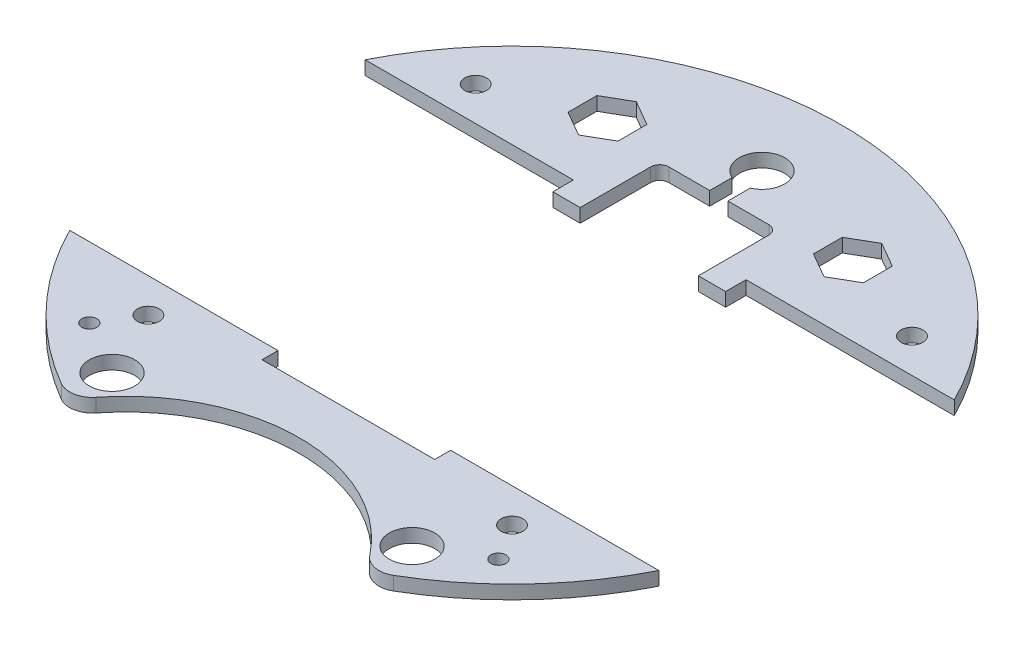
from build123d import *

# Parameters (mm, degrees)
BOSS_EXTRUDE1_DEPTH  = 3
SOLENOID_PLACEMENT_W = 38
SOLENOID_PLACEMENT_H = 64
CUT_EXTRUDE1_DEPTH   = 103.574363269
CUT_EXTRUDE5_DEPTH   = 103.574363269
SKETCH6_R            = 2.4
CUT_EXTRUDE6_DEPTH   = 103.574363269
CUT_EXTRUDE3_DEPTH   = 103.574363269
CUT_EXTRUDE7_DEPTH   = 98.289516393
SKETCH8_R            = 5
CUT_EXTRUDE8_DEPTH   = 98.289516393
CUT_EXTRUDE9_DEPTH   = 98.289516393
SKETCH10_R           = 1.65
CUT_EXTRUDE10_DEPTH  = 10


with BuildPart() as part:
    # Sketch1 → Boss-Extrude1 (new body)
    with BuildSketch(Plane(origin=(0, 0, 0), x_dir=(1, 0, 0), z_dir=(0, 1, 0))):
        with BuildLine():
            ThreePointArc((36.543377003, -62.616544118), (0, 72.5), (-36.543377003, -62.616544118))
            ThreePointArc((-36.543377003, -62.616544118), (-33.085954668, -63.20954405), (-30.089832649, -61.38507948))
            ThreePointArc((-30.089832649, -61.38507948), (0, -46.75), (30.089832649, -61.38507948))
            ThreePointArc((30.089832649, -61.38507948), (33.085954668, -63.20954405), (36.543377003, -62.616544118))
        make_face()
    extrude(amount=BOSS_EXTRUDE1_DEPTH)

    # solenoid placement → Cut-Extrude1 (cut, through all)
    with BuildSketch(Plane(origin=(0, 3, 0), x_dir=(1, 0, 0), z_dir=(0, 1, 0))):
        with Locations((0, -4)):
            Rectangle(SOLENOID_PLACEMENT_W, SOLENOID_PLACEMENT_H)
    extrude(amount=-CUT_EXTRUDE1_DEPTH, mode=Mode.SUBTRACT)

    # Sketch5 → Cut-Extrude5 (cut, through all)
    with BuildSketch(Plane(origin=(0, 3, 0), x_dir=(1, 0, 0), z_dir=(0, 1, 0))):
        Polygon((-21.5, 51.175426481), (-27, 54.350852961), (-32.5, 51.175426481), (-32.5, 44.824573519), (-27, 41.649147039), (-21.5, 44.824573519), align=None)
        Polygon((21.5, 51.175426481), (21.5, 44.824573519), (27, 41.649147039), (32.5, 44.824573519), (32.5, 51.175426481), (27, 54.350852961), align=None)
    extrude(amount=-CUT_EXTRUDE5_DEPTH, mode=Mode.SUBTRACT)

    # Sketch6 → Cut-Extrude6 (cut, through all)
    with BuildSketch(Plane(origin=(0, 3, 0), x_dir=(1, 0, 0), z_dir=(0, 1, 0))):
        with Locations((48, 40)):
            Circle(SKETCH6_R)
        with Locations((-48, 40)):
            Circle(SKETCH6_R)
        with Locations((40, -40)):
            Circle(SKETCH6_R)
        with Locations((-40, -40)):
            Circle(SKETCH6_R)
    extrude(amount=-CUT_EXTRUDE6_DEPTH, mode=Mode.SUBTRACT)

    # Sketch3 → Cut-Extrude3 (cut, through all)
    with BuildSketch(Plane(origin=(0, 3, 0), x_dir=(1, 0, 0), z_dir=(0, 1, 0))):
        Polygon((-19, 28), (-19, 32.5), (-72.5, 32.5), (-72.5, -32.5), (72.5, -32.5), (72.5, 32.5), (19, 32.5), (19, 28), align=None)
    extrude(amount=-CUT_EXTRUDE3_DEPTH, mode=Mode.SUBTRACT)


with BuildPart() as cut_extrude3_piece_1:
    # of the separate pieces the step leaves, piece 1, a body of its own (cut_extrude3_pieces)
    add(part.part.solids().sort_by_distance((64.807406984, 0, -32.5))[0])

    # Sketch7 → Cut-Extrude7 (cut, through all)
    with BuildSketch(Plane(origin=(0, 3, 0), x_dir=(1, 0, 0), z_dir=(0, 1, 0))):
        with BuildLine():
            Line((13, 28), (13, 43.5))
            ThreePointArc((13, 43.5), (12.414213562, 44.914213562), (11, 45.5))
            Line((11, 45.5), (-11, 45.5))
            ThreePointArc((-11, 45.5), (-12.414213562, 44.914213562), (-13, 43.5))
            Line((-13, 43.5), (-13, 28))
            Line((-13, 28), (13, 28))
        make_face()
    extrude(amount=-CUT_EXTRUDE7_DEPTH, mode=Mode.SUBTRACT)

    # Sketch9 → Cut-Extrude9 (cut, through all)
    with BuildSketch(Plane(origin=(0, 3, 0), x_dir=(1, 0, 0), z_dir=(0, 1, 0))):
        with BuildLine():
            Line((2, 0), (2, 50.417424305))
            ThreePointArc((2, 50.417424305), (0, 60), (-2, 50.417424305))
            Line((-2, 50.417424305), (-2, 0))
            ThreePointArc((-2, 0), (0, -2), (2, 0))
        make_face()
    extrude(amount=-CUT_EXTRUDE9_DEPTH, mode=Mode.SUBTRACT)


with BuildPart() as cut_extrude3_piece_2:
    # of the separate pieces the step leaves, piece 2, a body of its own (cut_extrude3_pieces)
    add(part.part.solids().sort_by_distance((-36.543377003, 0, 62.616544118))[0])

    # Sketch8 → Cut-Extrude8 (cut, through all)
    with BuildSketch(Plane(origin=(0, 3, 0), x_dir=(1, 0, 0), z_dir=(0, 1, 0))):
        with Locations((33, -55)):
            Circle(SKETCH8_R)
        with Locations((-33, -55)):
            Circle(SKETCH8_R)
    extrude(amount=-CUT_EXTRUDE8_DEPTH, mode=Mode.SUBTRACT)

    # Sketch10 → Cut-Extrude10 (cut)
    with BuildSketch(Plane(origin=(0, 3, 0), x_dir=(1, 0, 0), z_dir=(0, 1, 0))):
        with Locations((45, -48)):
            Circle(SKETCH10_R)
        with Locations((-45, -48)):
            Circle(SKETCH10_R)
    extrude(amount=-CUT_EXTRUDE10_DEPTH, mode=Mode.SUBTRACT)


solid = Compound([cut_extrude3_piece_1.part, cut_extrude3_piece_2.part])
